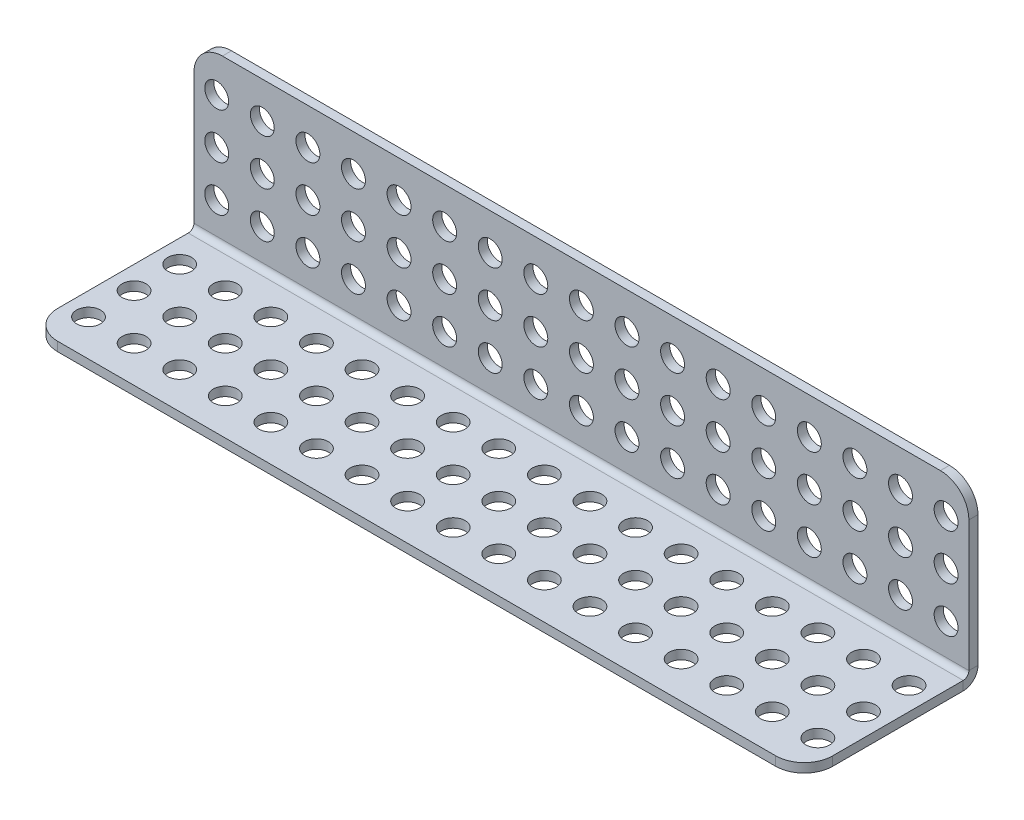
from build123d import *

# Parameters (mm, degrees)
BASE_FLANGE1_DEPTH         = 136
FILLET1_R                  = 5
SKETCH6_R                  = 2.1
CUT_EXTRUDE1_DEPTH         = 143.342755348
SKETCH7_R                  = 2.1
CUT_EXTRUDE2_DEPTH         = 143.342755348
LPATTERN2_COUNT            = 3
LPATTERN2_PITCH            = 8
LPATTERN3_COUNT            = 3
LPATTERN3_PITCH            = 8
LPATTERN1_COUNT            = 17
LPATTERN1_PITCH            = 8
LPATTERN1_COPY_1_SKETCH_R  = 2.1
LPATTERN1_COPY_1_DEPTH     = 143.342755348
LPATTERN1_COPY_2_SKETCH_R  = 2.1
LPATTERN1_COPY_2_DEPTH     = 143.342755348
LPATTERN1_COPY_3_SKETCH_R  = 2.1
LPATTERN1_COPY_3_DEPTH     = 143.342755348
LPATTERN1_COPY_4_SKETCH_R  = 2.1
LPATTERN1_COPY_4_DEPTH     = 143.342755348
LPATTERN1_COPY_5_SKETCH_R  = 2.1
LPATTERN1_COPY_5_DEPTH     = 143.342755348
LPATTERN1_COPY_6_SKETCH_R  = 2.1
LPATTERN1_COPY_6_DEPTH     = 143.342755348
LPATTERN1_COPY_7_SKETCH_R  = 2.1
LPATTERN1_COPY_7_DEPTH     = 143.342755348
LPATTERN1_COPY_8_SKETCH_R  = 2.1
LPATTERN1_COPY_8_DEPTH     = 143.342755348
LPATTERN1_COPY_9_SKETCH_R  = 2.1
LPATTERN1_COPY_9_DEPTH     = 143.342755348
LPATTERN1_COPY_10_SKETCH_R = 2.1
LPATTERN1_COPY_10_DEPTH    = 143.342755348
LPATTERN1_COPY_11_SKETCH_R = 2.1
LPATTERN1_COPY_11_DEPTH    = 143.342755348
LPATTERN1_COPY_12_SKETCH_R = 2.1
LPATTERN1_COPY_12_DEPTH    = 143.342755348
LPATTERN1_COPY_13_SKETCH_R = 2.1
LPATTERN1_COPY_13_DEPTH    = 143.342755348
LPATTERN1_COPY_14_SKETCH_R = 2.1
LPATTERN1_COPY_14_DEPTH    = 143.342755348
LPATTERN1_COPY_15_SKETCH_R = 2.1
LPATTERN1_COPY_15_DEPTH    = 143.342755348
LPATTERN1_COPY_16_SKETCH_R = 2.1
LPATTERN1_COPY_16_DEPTH    = 143.342755348
LPATTERN1_COPY_17_SKETCH_R = 2.1
LPATTERN1_COPY_17_DEPTH    = 143.342755348
LPATTERN1_COPY_18_SKETCH_R = 2.1
LPATTERN1_COPY_18_DEPTH    = 143.342755348
LPATTERN1_COPY_19_SKETCH_R = 2.1
LPATTERN1_COPY_19_DEPTH    = 143.342755348
LPATTERN1_COPY_20_SKETCH_R = 2.1
LPATTERN1_COPY_20_DEPTH    = 143.342755348
LPATTERN1_COPY_21_SKETCH_R = 2.1
LPATTERN1_COPY_21_DEPTH    = 143.342755348
LPATTERN1_COPY_22_SKETCH_R = 2.1
LPATTERN1_COPY_22_DEPTH    = 143.342755348
LPATTERN1_COPY_23_SKETCH_R = 2.1
LPATTERN1_COPY_23_DEPTH    = 143.342755348
LPATTERN1_COPY_24_SKETCH_R = 2.1
LPATTERN1_COPY_24_DEPTH    = 143.342755348
LPATTERN1_COPY_25_SKETCH_R = 2.1
LPATTERN1_COPY_25_DEPTH    = 143.342755348
LPATTERN1_COPY_26_SKETCH_R = 2.1
LPATTERN1_COPY_26_DEPTH    = 143.342755348
LPATTERN1_COPY_27_SKETCH_R = 2.1
LPATTERN1_COPY_27_DEPTH    = 143.342755348
LPATTERN1_COPY_28_SKETCH_R = 2.1
LPATTERN1_COPY_28_DEPTH    = 143.342755348
LPATTERN1_COPY_29_SKETCH_R = 2.1
LPATTERN1_COPY_29_DEPTH    = 143.342755348
LPATTERN1_COPY_30_SKETCH_R = 2.1
LPATTERN1_COPY_30_DEPTH    = 143.342755348
LPATTERN1_COPY_31_SKETCH_R = 2.1
LPATTERN1_COPY_31_DEPTH    = 143.342755348
LPATTERN1_COPY_32_SKETCH_R = 2.1
LPATTERN1_COPY_32_DEPTH    = 143.342755348
LPATTERN1_COPY_33_SKETCH_R = 2.1
LPATTERN1_COPY_33_DEPTH    = 143.342755348
LPATTERN1_COPY_34_SKETCH_R = 2.1
LPATTERN1_COPY_34_DEPTH    = 143.342755348
LPATTERN1_COPY_35_SKETCH_R = 2.1
LPATTERN1_COPY_35_DEPTH    = 143.342755348
LPATTERN1_COPY_36_SKETCH_R = 2.1
LPATTERN1_COPY_36_DEPTH    = 143.342755348
LPATTERN1_COPY_37_SKETCH_R = 2.1
LPATTERN1_COPY_37_DEPTH    = 143.342755348
LPATTERN1_COPY_38_SKETCH_R = 2.1
LPATTERN1_COPY_38_DEPTH    = 143.342755348
LPATTERN1_COPY_39_SKETCH_R = 2.1
LPATTERN1_COPY_39_DEPTH    = 143.342755348
LPATTERN1_COPY_40_SKETCH_R = 2.1
LPATTERN1_COPY_40_DEPTH    = 143.342755348
LPATTERN1_COPY_41_SKETCH_R = 2.1
LPATTERN1_COPY_41_DEPTH    = 143.342755348
LPATTERN1_COPY_42_SKETCH_R = 2.1
LPATTERN1_COPY_42_DEPTH    = 143.342755348
LPATTERN1_COPY_43_SKETCH_R = 2.1
LPATTERN1_COPY_43_DEPTH    = 143.342755348
LPATTERN1_COPY_44_SKETCH_R = 2.1
LPATTERN1_COPY_44_DEPTH    = 143.342755348
LPATTERN1_COPY_45_SKETCH_R = 2.1
LPATTERN1_COPY_45_DEPTH    = 143.342755348
LPATTERN1_COPY_46_SKETCH_R = 2.1
LPATTERN1_COPY_46_DEPTH    = 143.342755348
LPATTERN1_COPY_47_SKETCH_R = 2.1
LPATTERN1_COPY_47_DEPTH    = 143.342755348
LPATTERN1_COPY_48_SKETCH_R = 2.1
LPATTERN1_COPY_48_DEPTH    = 143.342755348
LPATTERN1_COPY_49_SKETCH_R = 2.1
LPATTERN1_COPY_49_DEPTH    = 143.342755348
LPATTERN1_COPY_50_SKETCH_R = 2.1
LPATTERN1_COPY_50_DEPTH    = 143.342755348
LPATTERN1_COPY_51_SKETCH_R = 2.1
LPATTERN1_COPY_51_DEPTH    = 143.342755348
LPATTERN1_COPY_52_SKETCH_R = 2.1
LPATTERN1_COPY_52_DEPTH    = 143.342755348
LPATTERN1_COPY_53_SKETCH_R = 2.1
LPATTERN1_COPY_53_DEPTH    = 143.342755348
LPATTERN1_COPY_54_SKETCH_R = 2.1
LPATTERN1_COPY_54_DEPTH    = 143.342755348
LPATTERN1_COPY_55_SKETCH_R = 2.1
LPATTERN1_COPY_55_DEPTH    = 143.342755348
LPATTERN1_COPY_56_SKETCH_R = 2.1
LPATTERN1_COPY_56_DEPTH    = 143.342755348
LPATTERN1_COPY_57_SKETCH_R = 2.1
LPATTERN1_COPY_57_DEPTH    = 143.342755348
LPATTERN1_COPY_58_SKETCH_R = 2.1
LPATTERN1_COPY_58_DEPTH    = 143.342755348
LPATTERN1_COPY_59_SKETCH_R = 2.1
LPATTERN1_COPY_59_DEPTH    = 143.342755348
LPATTERN1_COPY_60_SKETCH_R = 2.1
LPATTERN1_COPY_60_DEPTH    = 143.342755348
LPATTERN1_COPY_61_SKETCH_R = 2.1
LPATTERN1_COPY_61_DEPTH    = 143.342755348
LPATTERN1_COPY_62_SKETCH_R = 2.1
LPATTERN1_COPY_62_DEPTH    = 143.342755348
LPATTERN1_COPY_63_SKETCH_R = 2.1
LPATTERN1_COPY_63_DEPTH    = 143.342755348
LPATTERN1_COPY_64_SKETCH_R = 2.1
LPATTERN1_COPY_64_DEPTH    = 143.342755348


# Sheet-metal steps are written as plain solids
with BuildPart() as part:
    # Sketch1 → Base-Flange1 (new body)
    with BuildSketch(Plane(origin=(0, 0, 0), x_dir=(0, 0, -1), z_dir=(1, 0, 0))):
        with BuildLine():
            Line((0, 30.5), (0, 2.6))
            ThreePointArc((0, 2.6), (-0.761522369, 0.761522369), (-2.6, 0))
            Line((-2.6, 0), (-30.5, 0))
            Line((-30.5, 0), (-30.5, 1.6))
            Line((-30.5, 1.6), (-2.6, 1.6))
            ThreePointArc((-2.6, 1.6), (-1.892893219, 1.892893219), (-1.6, 2.6))
            Line((-1.6, 2.6), (-1.6, 30.5))
            Line((-1.6, 30.5), (0, 30.5))
        make_face()
    extrude(amount=BASE_FLANGE1_DEPTH)

    # Fillet1
    fillet1_edges = [part.edges().sort_by_distance(p)[0] for p in [
        (136, 30.5, 0.8),
        (136, 0.8, 30.5),
        (0, 30.5, 0.8),
        (0, 0.8, 30.5),
    ]]
    fillet(fillet1_edges, radius=FILLET1_R)

    # Sketch6 → Cut-Extrude1 (cut, through all)
    with BuildSketch(Plane.XY.offset(1.6)):
        with Locations((4, 8.1)):
            Circle(SKETCH6_R)
    cut_extrude1 = extrude(amount=-CUT_EXTRUDE1_DEPTH, mode=Mode.SUBTRACT)

    # Sketch7 → Cut-Extrude2 (cut, through all)
    with BuildSketch(Plane(origin=(0, 1.6, 0), x_dir=(1, 0, 0), z_dir=(0, 1, 0))):
        with Locations(Location((4, -8.1, 0), (0, 0, 270))):
            Circle(SKETCH7_R)
    cut_extrude2 = extrude(amount=-CUT_EXTRUDE2_DEPTH, mode=Mode.SUBTRACT)

    # LPattern2: Cut-Extrude1 ×3
    with Locations(*[(0, i * LPATTERN2_PITCH, 0) for i in range(1, LPATTERN2_COUNT)]):
        add(cut_extrude1, mode=Mode.SUBTRACT)

    # LPattern3: Cut-Extrude2 ×3
    with Locations(*[(0, 0, i * LPATTERN3_PITCH) for i in range(1, LPATTERN3_COUNT)]):
        add(cut_extrude2, mode=Mode.SUBTRACT)

    # LPattern1: Cut-Extrude1, Cut-Extrude2 ×17
    with Locations(*[(i * LPATTERN1_PITCH, 0, 0) for i in range(1, LPATTERN1_COUNT)]):
        add(cut_extrude1, mode=Mode.SUBTRACT)
        add(cut_extrude2, mode=Mode.SUBTRACT)

    # LPattern1 copy 1 sketch → LPattern1 copy 1 (cut, through all)
    with BuildSketch(Plane(origin=(8, 8, 1.6), x_dir=(1, 0, 0), z_dir=(0, 0, 1))):
        with Locations((4, 8.1)):
            Circle(LPATTERN1_COPY_1_SKETCH_R)
    extrude(amount=-LPATTERN1_COPY_1_DEPTH, mode=Mode.SUBTRACT)

    # LPattern1 copy 2 sketch → LPattern1 copy 2 (cut, through all)
    with BuildSketch(Plane(origin=(16, 8, 1.6), x_dir=(1, 0, 0), z_dir=(0, 0, 1))):
        with Locations((4, 8.1)):
            Circle(LPATTERN1_COPY_2_SKETCH_R)
    extrude(amount=-LPATTERN1_COPY_2_DEPTH, mode=Mode.SUBTRACT)

    # LPattern1 copy 3 sketch → LPattern1 copy 3 (cut, through all)
    with BuildSketch(Plane(origin=(24, 8, 1.6), x_dir=(1, 0, 0), z_dir=(0, 0, 1))):
        with Locations((4, 8.1)):
            Circle(LPATTERN1_COPY_3_SKETCH_R)
    extrude(amount=-LPATTERN1_COPY_3_DEPTH, mode=Mode.SUBTRACT)

    # LPattern1 copy 4 sketch → LPattern1 copy 4 (cut, through all)
    with BuildSketch(Plane(origin=(32, 8, 1.6), x_dir=(1, 0, 0), z_dir=(0, 0, 1))):
        with Locations((4, 8.1)):
            Circle(LPATTERN1_COPY_4_SKETCH_R)
    extrude(amount=-LPATTERN1_COPY_4_DEPTH, mode=Mode.SUBTRACT)

    # LPattern1 copy 5 sketch → LPattern1 copy 5 (cut, through all)
    with BuildSketch(Plane(origin=(40, 8, 1.6), x_dir=(1, 0, 0), z_dir=(0, 0, 1))):
        with Locations((4, 8.1)):
            Circle(LPATTERN1_COPY_5_SKETCH_R)
    extrude(amount=-LPATTERN1_COPY_5_DEPTH, mode=Mode.SUBTRACT)

    # LPattern1 copy 6 sketch → LPattern1 copy 6 (cut, through all)
    with BuildSketch(Plane(origin=(48, 8, 1.6), x_dir=(1, 0, 0), z_dir=(0, 0, 1))):
        with Locations((4, 8.1)):
            Circle(LPATTERN1_COPY_6_SKETCH_R)
    extrude(amount=-LPATTERN1_COPY_6_DEPTH, mode=Mode.SUBTRACT)

    # LPattern1 copy 7 sketch → LPattern1 copy 7 (cut, through all)
    with BuildSketch(Plane(origin=(56, 8, 1.6), x_dir=(1, 0, 0), z_dir=(0, 0, 1))):
        with Locations((4, 8.1)):
            Circle(LPATTERN1_COPY_7_SKETCH_R)
    extrude(amount=-LPATTERN1_COPY_7_DEPTH, mode=Mode.SUBTRACT)

    # LPattern1 copy 8 sketch → LPattern1 copy 8 (cut, through all)
    with BuildSketch(Plane(origin=(64, 8, 1.6), x_dir=(1, 0, 0), z_dir=(0, 0, 1))):
        with Locations((4, 8.1)):
            Circle(LPATTERN1_COPY_8_SKETCH_R)
    extrude(amount=-LPATTERN1_COPY_8_DEPTH, mode=Mode.SUBTRACT)

    # LPattern1 copy 9 sketch → LPattern1 copy 9 (cut, through all)
    with BuildSketch(Plane(origin=(72, 8, 1.6), x_dir=(1, 0, 0), z_dir=(0, 0, 1))):
        with Locations((4, 8.1)):
            Circle(LPATTERN1_COPY_9_SKETCH_R)
    extrude(amount=-LPATTERN1_COPY_9_DEPTH, mode=Mode.SUBTRACT)

    # LPattern1 copy 10 sketch → LPattern1 copy 10 (cut, through all)
    with BuildSketch(Plane(origin=(80, 8, 1.6), x_dir=(1, 0, 0), z_dir=(0, 0, 1))):
        with Locations((4, 8.1)):
            Circle(LPATTERN1_COPY_10_SKETCH_R)
    extrude(amount=-LPATTERN1_COPY_10_DEPTH, mode=Mode.SUBTRACT)

    # LPattern1 copy 11 sketch → LPattern1 copy 11 (cut, through all)
    with BuildSketch(Plane(origin=(88, 8, 1.6), x_dir=(1, 0, 0), z_dir=(0, 0, 1))):
        with Locations((4, 8.1)):
            Circle(LPATTERN1_COPY_11_SKETCH_R)
    extrude(amount=-LPATTERN1_COPY_11_DEPTH, mode=Mode.SUBTRACT)

    # LPattern1 copy 12 sketch → LPattern1 copy 12 (cut, through all)
    with BuildSketch(Plane(origin=(96, 8, 1.6), x_dir=(1, 0, 0), z_dir=(0, 0, 1))):
        with Locations((4, 8.1)):
            Circle(LPATTERN1_COPY_12_SKETCH_R)
    extrude(amount=-LPATTERN1_COPY_12_DEPTH, mode=Mode.SUBTRACT)

    # LPattern1 copy 13 sketch → LPattern1 copy 13 (cut, through all)
    with BuildSketch(Plane(origin=(104, 8, 1.6), x_dir=(1, 0, 0), z_dir=(0, 0, 1))):
        with Locations((4, 8.1)):
            Circle(LPATTERN1_COPY_13_SKETCH_R)
    extrude(amount=-LPATTERN1_COPY_13_DEPTH, mode=Mode.SUBTRACT)

    # LPattern1 copy 14 sketch → LPattern1 copy 14 (cut, through all)
    with BuildSketch(Plane(origin=(112, 8, 1.6), x_dir=(1, 0, 0), z_dir=(0, 0, 1))):
        with Locations((4, 8.1)):
            Circle(LPATTERN1_COPY_14_SKETCH_R)
    extrude(amount=-LPATTERN1_COPY_14_DEPTH, mode=Mode.SUBTRACT)

    # LPattern1 copy 15 sketch → LPattern1 copy 15 (cut, through all)
    with BuildSketch(Plane(origin=(120, 8, 1.6), x_dir=(1, 0, 0), z_dir=(0, 0, 1))):
        with Locations((4, 8.1)):
            Circle(LPATTERN1_COPY_15_SKETCH_R)
    extrude(amount=-LPATTERN1_COPY_15_DEPTH, mode=Mode.SUBTRACT)

    # LPattern1 copy 16 sketch → LPattern1 copy 16 (cut, through all)
    with BuildSketch(Plane(origin=(128, 8, 1.6), x_dir=(1, 0, 0), z_dir=(0, 0, 1))):
        with Locations((4, 8.1)):
            Circle(LPATTERN1_COPY_16_SKETCH_R)
    extrude(amount=-LPATTERN1_COPY_16_DEPTH, mode=Mode.SUBTRACT)

    # LPattern1 copy 17 sketch → LPattern1 copy 17 (cut, through all)
    with BuildSketch(Plane(origin=(8, 16, 1.6), x_dir=(1, 0, 0), z_dir=(0, 0, 1))):
        with Locations((4, 8.1)):
            Circle(LPATTERN1_COPY_17_SKETCH_R)
    extrude(amount=-LPATTERN1_COPY_17_DEPTH, mode=Mode.SUBTRACT)

    # LPattern1 copy 18 sketch → LPattern1 copy 18 (cut, through all)
    with BuildSketch(Plane(origin=(16, 16, 1.6), x_dir=(1, 0, 0), z_dir=(0, 0, 1))):
        with Locations((4, 8.1)):
            Circle(LPATTERN1_COPY_18_SKETCH_R)
    extrude(amount=-LPATTERN1_COPY_18_DEPTH, mode=Mode.SUBTRACT)

    # LPattern1 copy 19 sketch → LPattern1 copy 19 (cut, through all)
    with BuildSketch(Plane(origin=(24, 16, 1.6), x_dir=(1, 0, 0), z_dir=(0, 0, 1))):
        with Locations((4, 8.1)):
            Circle(LPATTERN1_COPY_19_SKETCH_R)
    extrude(amount=-LPATTERN1_COPY_19_DEPTH, mode=Mode.SUBTRACT)

    # LPattern1 copy 20 sketch → LPattern1 copy 20 (cut, through all)
    with BuildSketch(Plane(origin=(32, 16, 1.6), x_dir=(1, 0, 0), z_dir=(0, 0, 1))):
        with Locations((4, 8.1)):
            Circle(LPATTERN1_COPY_20_SKETCH_R)
    extrude(amount=-LPATTERN1_COPY_20_DEPTH, mode=Mode.SUBTRACT)

    # LPattern1 copy 21 sketch → LPattern1 copy 21 (cut, through all)
    with BuildSketch(Plane(origin=(40, 16, 1.6), x_dir=(1, 0, 0), z_dir=(0, 0, 1))):
        with Locations((4, 8.1)):
            Circle(LPATTERN1_COPY_21_SKETCH_R)
    extrude(amount=-LPATTERN1_COPY_21_DEPTH, mode=Mode.SUBTRACT)

    # LPattern1 copy 22 sketch → LPattern1 copy 22 (cut, through all)
    with BuildSketch(Plane(origin=(48, 16, 1.6), x_dir=(1, 0, 0), z_dir=(0, 0, 1))):
        with Locations((4, 8.1)):
            Circle(LPATTERN1_COPY_22_SKETCH_R)
    extrude(amount=-LPATTERN1_COPY_22_DEPTH, mode=Mode.SUBTRACT)

    # LPattern1 copy 23 sketch → LPattern1 copy 23 (cut, through all)
    with BuildSketch(Plane(origin=(56, 16, 1.6), x_dir=(1, 0, 0), z_dir=(0, 0, 1))):
        with Locations((4, 8.1)):
            Circle(LPATTERN1_COPY_23_SKETCH_R)
    extrude(amount=-LPATTERN1_COPY_23_DEPTH, mode=Mode.SUBTRACT)

    # LPattern1 copy 24 sketch → LPattern1 copy 24 (cut, through all)
    with BuildSketch(Plane(origin=(64, 16, 1.6), x_dir=(1, 0, 0), z_dir=(0, 0, 1))):
        with Locations((4, 8.1)):
            Circle(LPATTERN1_COPY_24_SKETCH_R)
    extrude(amount=-LPATTERN1_COPY_24_DEPTH, mode=Mode.SUBTRACT)

    # LPattern1 copy 25 sketch → LPattern1 copy 25 (cut, through all)
    with BuildSketch(Plane(origin=(72, 16, 1.6), x_dir=(1, 0, 0), z_dir=(0, 0, 1))):
        with Locations((4, 8.1)):
            Circle(LPATTERN1_COPY_25_SKETCH_R)
    extrude(amount=-LPATTERN1_COPY_25_DEPTH, mode=Mode.SUBTRACT)

    # LPattern1 copy 26 sketch → LPattern1 copy 26 (cut, through all)
    with BuildSketch(Plane(origin=(80, 16, 1.6), x_dir=(1, 0, 0), z_dir=(0, 0, 1))):
        with Locations((4, 8.1)):
            Circle(LPATTERN1_COPY_26_SKETCH_R)
    extrude(amount=-LPATTERN1_COPY_26_DEPTH, mode=Mode.SUBTRACT)

    # LPattern1 copy 27 sketch → LPattern1 copy 27 (cut, through all)
    with BuildSketch(Plane(origin=(88, 16, 1.6), x_dir=(1, 0, 0), z_dir=(0, 0, 1))):
        with Locations((4, 8.1)):
            Circle(LPATTERN1_COPY_27_SKETCH_R)
    extrude(amount=-LPATTERN1_COPY_27_DEPTH, mode=Mode.SUBTRACT)

    # LPattern1 copy 28 sketch → LPattern1 copy 28 (cut, through all)
    with BuildSketch(Plane(origin=(96, 16, 1.6), x_dir=(1, 0, 0), z_dir=(0, 0, 1))):
        with Locations((4, 8.1)):
            Circle(LPATTERN1_COPY_28_SKETCH_R)
    extrude(amount=-LPATTERN1_COPY_28_DEPTH, mode=Mode.SUBTRACT)

    # LPattern1 copy 29 sketch → LPattern1 copy 29 (cut, through all)
    with BuildSketch(Plane(origin=(104, 16, 1.6), x_dir=(1, 0, 0), z_dir=(0, 0, 1))):
        with Locations((4, 8.1)):
            Circle(LPATTERN1_COPY_29_SKETCH_R)
    extrude(amount=-LPATTERN1_COPY_29_DEPTH, mode=Mode.SUBTRACT)

    # LPattern1 copy 30 sketch → LPattern1 copy 30 (cut, through all)
    with BuildSketch(Plane(origin=(112, 16, 1.6), x_dir=(1, 0, 0), z_dir=(0, 0, 1))):
        with Locations((4, 8.1)):
            Circle(LPATTERN1_COPY_30_SKETCH_R)
    extrude(amount=-LPATTERN1_COPY_30_DEPTH, mode=Mode.SUBTRACT)

    # LPattern1 copy 31 sketch → LPattern1 copy 31 (cut, through all)
    with BuildSketch(Plane(origin=(120, 16, 1.6), x_dir=(1, 0, 0), z_dir=(0, 0, 1))):
        with Locations((4, 8.1)):
            Circle(LPATTERN1_COPY_31_SKETCH_R)
    extrude(amount=-LPATTERN1_COPY_31_DEPTH, mode=Mode.SUBTRACT)

    # LPattern1 copy 32 sketch → LPattern1 copy 32 (cut, through all)
    with BuildSketch(Plane(origin=(128, 16, 1.6), x_dir=(1, 0, 0), z_dir=(0, 0, 1))):
        with Locations((4, 8.1)):
            Circle(LPATTERN1_COPY_32_SKETCH_R)
    extrude(amount=-LPATTERN1_COPY_32_DEPTH, mode=Mode.SUBTRACT)

    # LPattern1 copy 33 sketch → LPattern1 copy 33 (cut, through all)
    with BuildSketch(Plane(origin=(8, 1.6, 8), x_dir=(1, 0, 0), z_dir=(0, 1, 0))):
        with Locations(Location((4, -8.1, 0), (0, 0, 270))):
            Circle(LPATTERN1_COPY_33_SKETCH_R)
    extrude(amount=-LPATTERN1_COPY_33_DEPTH, mode=Mode.SUBTRACT)

    # LPattern1 copy 34 sketch → LPattern1 copy 34 (cut, through all)
    with BuildSketch(Plane(origin=(16, 1.6, 8), x_dir=(1, 0, 0), z_dir=(0, 1, 0))):
        with Locations(Location((4, -8.1, 0), (0, 0, 270))):
            Circle(LPATTERN1_COPY_34_SKETCH_R)
    extrude(amount=-LPATTERN1_COPY_34_DEPTH, mode=Mode.SUBTRACT)

    # LPattern1 copy 35 sketch → LPattern1 copy 35 (cut, through all)
    with BuildSketch(Plane(origin=(24, 1.6, 8), x_dir=(1, 0, 0), z_dir=(0, 1, 0))):
        with Locations(Location((4, -8.1, 0), (0, 0, 270))):
            Circle(LPATTERN1_COPY_35_SKETCH_R)
    extrude(amount=-LPATTERN1_COPY_35_DEPTH, mode=Mode.SUBTRACT)

    # LPattern1 copy 36 sketch → LPattern1 copy 36 (cut, through all)
    with BuildSketch(Plane(origin=(32, 1.6, 8), x_dir=(1, 0, 0), z_dir=(0, 1, 0))):
        with Locations(Location((4, -8.1, 0), (0, 0, 270))):
            Circle(LPATTERN1_COPY_36_SKETCH_R)
    extrude(amount=-LPATTERN1_COPY_36_DEPTH, mode=Mode.SUBTRACT)

    # LPattern1 copy 37 sketch → LPattern1 copy 37 (cut, through all)
    with BuildSketch(Plane(origin=(40, 1.6, 8), x_dir=(1, 0, 0), z_dir=(0, 1, 0))):
        with Locations(Location((4, -8.1, 0), (0, 0, 270))):
            Circle(LPATTERN1_COPY_37_SKETCH_R)
    extrude(amount=-LPATTERN1_COPY_37_DEPTH, mode=Mode.SUBTRACT)

    # LPattern1 copy 38 sketch → LPattern1 copy 38 (cut, through all)
    with BuildSketch(Plane(origin=(48, 1.6, 8), x_dir=(1, 0, 0), z_dir=(0, 1, 0))):
        with Locations(Location((4, -8.1, 0), (0, 0, 270))):
            Circle(LPATTERN1_COPY_38_SKETCH_R)
    extrude(amount=-LPATTERN1_COPY_38_DEPTH, mode=Mode.SUBTRACT)

    # LPattern1 copy 39 sketch → LPattern1 copy 39 (cut, through all)
    with BuildSketch(Plane(origin=(56, 1.6, 8), x_dir=(1, 0, 0), z_dir=(0, 1, 0))):
        with Locations(Location((4, -8.1, 0), (0, 0, 270))):
            Circle(LPATTERN1_COPY_39_SKETCH_R)
    extrude(amount=-LPATTERN1_COPY_39_DEPTH, mode=Mode.SUBTRACT)

    # LPattern1 copy 40 sketch → LPattern1 copy 40 (cut, through all)
    with BuildSketch(Plane(origin=(64, 1.6, 8), x_dir=(1, 0, 0), z_dir=(0, 1, 0))):
        with Locations(Location((4, -8.1, 0), (0, 0, 270))):
            Circle(LPATTERN1_COPY_40_SKETCH_R)
    extrude(amount=-LPATTERN1_COPY_40_DEPTH, mode=Mode.SUBTRACT)

    # LPattern1 copy 41 sketch → LPattern1 copy 41 (cut, through all)
    with BuildSketch(Plane(origin=(72, 1.6, 8), x_dir=(1, 0, 0), z_dir=(0, 1, 0))):
        with Locations(Location((4, -8.1, 0), (0, 0, 270))):
            Circle(LPATTERN1_COPY_41_SKETCH_R)
    extrude(amount=-LPATTERN1_COPY_41_DEPTH, mode=Mode.SUBTRACT)

    # LPattern1 copy 42 sketch → LPattern1 copy 42 (cut, through all)
    with BuildSketch(Plane(origin=(80, 1.6, 8), x_dir=(1, 0, 0), z_dir=(0, 1, 0))):
        with Locations(Location((4, -8.1, 0), (0, 0, 270))):
            Circle(LPATTERN1_COPY_42_SKETCH_R)
    extrude(amount=-LPATTERN1_COPY_42_DEPTH, mode=Mode.SUBTRACT)

    # LPattern1 copy 43 sketch → LPattern1 copy 43 (cut, through all)
    with BuildSketch(Plane(origin=(88, 1.6, 8), x_dir=(1, 0, 0), z_dir=(0, 1, 0))):
        with Locations(Location((4, -8.1, 0), (0, 0, 270))):
            Circle(LPATTERN1_COPY_43_SKETCH_R)
    extrude(amount=-LPATTERN1_COPY_43_DEPTH, mode=Mode.SUBTRACT)

    # LPattern1 copy 44 sketch → LPattern1 copy 44 (cut, through all)
    with BuildSketch(Plane(origin=(96, 1.6, 8), x_dir=(1, 0, 0), z_dir=(0, 1, 0))):
        with Locations(Location((4, -8.1, 0), (0, 0, 270))):
            Circle(LPATTERN1_COPY_44_SKETCH_R)
    extrude(amount=-LPATTERN1_COPY_44_DEPTH, mode=Mode.SUBTRACT)

    # LPattern1 copy 45 sketch → LPattern1 copy 45 (cut, through all)
    with BuildSketch(Plane(origin=(104, 1.6, 8), x_dir=(1, 0, 0), z_dir=(0, 1, 0))):
        with Locations(Location((4, -8.1, 0), (0, 0, 270))):
            Circle(LPATTERN1_COPY_45_SKETCH_R)
    extrude(amount=-LPATTERN1_COPY_45_DEPTH, mode=Mode.SUBTRACT)

    # LPattern1 copy 46 sketch → LPattern1 copy 46 (cut, through all)
    with BuildSketch(Plane(origin=(112, 1.6, 8), x_dir=(1, 0, 0), z_dir=(0, 1, 0))):
        with Locations(Location((4, -8.1, 0), (0, 0, 270))):
            Circle(LPATTERN1_COPY_46_SKETCH_R)
    extrude(amount=-LPATTERN1_COPY_46_DEPTH, mode=Mode.SUBTRACT)

    # LPattern1 copy 47 sketch → LPattern1 copy 47 (cut, through all)
    with BuildSketch(Plane(origin=(120, 1.6, 8), x_dir=(1, 0, 0), z_dir=(0, 1, 0))):
        with Locations(Location((4, -8.1, 0), (0, 0, 270))):
            Circle(LPATTERN1_COPY_47_SKETCH_R)
    extrude(amount=-LPATTERN1_COPY_47_DEPTH, mode=Mode.SUBTRACT)

    # LPattern1 copy 48 sketch → LPattern1 copy 48 (cut, through all)
    with BuildSketch(Plane(origin=(128, 1.6, 8), x_dir=(1, 0, 0), z_dir=(0, 1, 0))):
        with Locations(Location((4, -8.1, 0), (0, 0, 270))):
            Circle(LPATTERN1_COPY_48_SKETCH_R)
    extrude(amount=-LPATTERN1_COPY_48_DEPTH, mode=Mode.SUBTRACT)

    # LPattern1 copy 49 sketch → LPattern1 copy 49 (cut, through all)
    with BuildSketch(Plane(origin=(8, 1.6, 16), x_dir=(1, 0, 0), z_dir=(0, 1, 0))):
        with Locations(Location((4, -8.1, 0), (0, 0, 270))):
            Circle(LPATTERN1_COPY_49_SKETCH_R)
    extrude(amount=-LPATTERN1_COPY_49_DEPTH, mode=Mode.SUBTRACT)

    # LPattern1 copy 50 sketch → LPattern1 copy 50 (cut, through all)
    with BuildSketch(Plane(origin=(16, 1.6, 16), x_dir=(1, 0, 0), z_dir=(0, 1, 0))):
        with Locations(Location((4, -8.1, 0), (0, 0, 270))):
            Circle(LPATTERN1_COPY_50_SKETCH_R)
    extrude(amount=-LPATTERN1_COPY_50_DEPTH, mode=Mode.SUBTRACT)

    # LPattern1 copy 51 sketch → LPattern1 copy 51 (cut, through all)
    with BuildSketch(Plane(origin=(24, 1.6, 16), x_dir=(1, 0, 0), z_dir=(0, 1, 0))):
        with Locations(Location((4, -8.1, 0), (0, 0, 270))):
            Circle(LPATTERN1_COPY_51_SKETCH_R)
    extrude(amount=-LPATTERN1_COPY_51_DEPTH, mode=Mode.SUBTRACT)

    # LPattern1 copy 52 sketch → LPattern1 copy 52 (cut, through all)
    with BuildSketch(Plane(origin=(32, 1.6, 16), x_dir=(1, 0, 0), z_dir=(0, 1, 0))):
        with Locations(Location((4, -8.1, 0), (0, 0, 270))):
            Circle(LPATTERN1_COPY_52_SKETCH_R)
    extrude(amount=-LPATTERN1_COPY_52_DEPTH, mode=Mode.SUBTRACT)

    # LPattern1 copy 53 sketch → LPattern1 copy 53 (cut, through all)
    with BuildSketch(Plane(origin=(40, 1.6, 16), x_dir=(1, 0, 0), z_dir=(0, 1, 0))):
        with Locations(Location((4, -8.1, 0), (0, 0, 270))):
            Circle(LPATTERN1_COPY_53_SKETCH_R)
    extrude(amount=-LPATTERN1_COPY_53_DEPTH, mode=Mode.SUBTRACT)

    # LPattern1 copy 54 sketch → LPattern1 copy 54 (cut, through all)
    with BuildSketch(Plane(origin=(48, 1.6, 16), x_dir=(1, 0, 0), z_dir=(0, 1, 0))):
        with Locations(Location((4, -8.1, 0), (0, 0, 270))):
            Circle(LPATTERN1_COPY_54_SKETCH_R)
    extrude(amount=-LPATTERN1_COPY_54_DEPTH, mode=Mode.SUBTRACT)

    # LPattern1 copy 55 sketch → LPattern1 copy 55 (cut, through all)
    with BuildSketch(Plane(origin=(56, 1.6, 16), x_dir=(1, 0, 0), z_dir=(0, 1, 0))):
        with Locations(Location((4, -8.1, 0), (0, 0, 270))):
            Circle(LPATTERN1_COPY_55_SKETCH_R)
    extrude(amount=-LPATTERN1_COPY_55_DEPTH, mode=Mode.SUBTRACT)

    # LPattern1 copy 56 sketch → LPattern1 copy 56 (cut, through all)
    with BuildSketch(Plane(origin=(64, 1.6, 16), x_dir=(1, 0, 0), z_dir=(0, 1, 0))):
        with Locations(Location((4, -8.1, 0), (0, 0, 270))):
            Circle(LPATTERN1_COPY_56_SKETCH_R)
    extrude(amount=-LPATTERN1_COPY_56_DEPTH, mode=Mode.SUBTRACT)

    # LPattern1 copy 57 sketch → LPattern1 copy 57 (cut, through all)
    with BuildSketch(Plane(origin=(72, 1.6, 16), x_dir=(1, 0, 0), z_dir=(0, 1, 0))):
        with Locations(Location((4, -8.1, 0), (0, 0, 270))):
            Circle(LPATTERN1_COPY_57_SKETCH_R)
    extrude(amount=-LPATTERN1_COPY_57_DEPTH, mode=Mode.SUBTRACT)

    # LPattern1 copy 58 sketch → LPattern1 copy 58 (cut, through all)
    with BuildSketch(Plane(origin=(80, 1.6, 16), x_dir=(1, 0, 0), z_dir=(0, 1, 0))):
        with Locations(Location((4, -8.1, 0), (0, 0, 270))):
            Circle(LPATTERN1_COPY_58_SKETCH_R)
    extrude(amount=-LPATTERN1_COPY_58_DEPTH, mode=Mode.SUBTRACT)

    # LPattern1 copy 59 sketch → LPattern1 copy 59 (cut, through all)
    with BuildSketch(Plane(origin=(88, 1.6, 16), x_dir=(1, 0, 0), z_dir=(0, 1, 0))):
        with Locations(Location((4, -8.1, 0), (0, 0, 270))):
            Circle(LPATTERN1_COPY_59_SKETCH_R)
    extrude(amount=-LPATTERN1_COPY_59_DEPTH, mode=Mode.SUBTRACT)

    # LPattern1 copy 60 sketch → LPattern1 copy 60 (cut, through all)
    with BuildSketch(Plane(origin=(96, 1.6, 16), x_dir=(1, 0, 0), z_dir=(0, 1, 0))):
        with Locations(Location((4, -8.1, 0), (0, 0, 270))):
            Circle(LPATTERN1_COPY_60_SKETCH_R)
    extrude(amount=-LPATTERN1_COPY_60_DEPTH, mode=Mode.SUBTRACT)

    # LPattern1 copy 61 sketch → LPattern1 copy 61 (cut, through all)
    with BuildSketch(Plane(origin=(104, 1.6, 16), x_dir=(1, 0, 0), z_dir=(0, 1, 0))):
        with Locations(Location((4, -8.1, 0), (0, 0, 270))):
            Circle(LPATTERN1_COPY_61_SKETCH_R)
    extrude(amount=-LPATTERN1_COPY_61_DEPTH, mode=Mode.SUBTRACT)

    # LPattern1 copy 62 sketch → LPattern1 copy 62 (cut, through all)
    with BuildSketch(Plane(origin=(112, 1.6, 16), x_dir=(1, 0, 0), z_dir=(0, 1, 0))):
        with Locations(Location((4, -8.1, 0), (0, 0, 270))):
            Circle(LPATTERN1_COPY_62_SKETCH_R)
    extrude(amount=-LPATTERN1_COPY_62_DEPTH, mode=Mode.SUBTRACT)

    # LPattern1 copy 63 sketch → LPattern1 copy 63 (cut, through all)
    with BuildSketch(Plane(origin=(120, 1.6, 16), x_dir=(1, 0, 0), z_dir=(0, 1, 0))):
        with Locations(Location((4, -8.1, 0), (0, 0, 270))):
            Circle(LPATTERN1_COPY_63_SKETCH_R)
    extrude(amount=-LPATTERN1_COPY_63_DEPTH, mode=Mode.SUBTRACT)

    # LPattern1 copy 64 sketch → LPattern1 copy 64 (cut, through all)
    with BuildSketch(Plane(origin=(128, 1.6, 16), x_dir=(1, 0, 0), z_dir=(0, 1, 0))):
        with Locations(Location((4, -8.1, 0), (0, 0, 270))):
            Circle(LPATTERN1_COPY_64_SKETCH_R)
    extrude(amount=-LPATTERN1_COPY_64_DEPTH, mode=Mode.SUBTRACT)


solid = part.part
